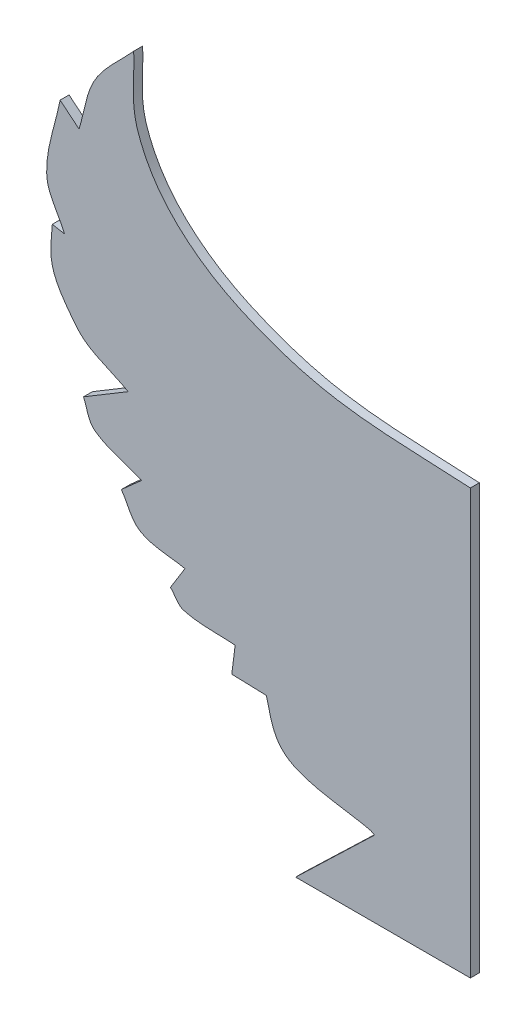
from build123d import *

# Parameters (mm, degrees)
BOSS_EXTRUDE1_DEPTH   = 6.35
BOSS_EXTRUDE1_2_DEPTH = 6.35
SPLIT1_DEPTH          = 6.35


with BuildPart() as part:
    # Sketch3 → Boss-Extrude1 (new body)
    with BuildSketch(Plane.XY):
        with BuildLine():
            Line((-137.255, 0), (-13.43, 0))
            Line((-13.43, 0), (-13.43, 300.741120307))
            add(Edge.make_bspline(
                [(-252.01, 449.51), (-251.22, 434.236666667), (-254.156340493, 418.301689829), (-249.64, 403.69), (-244.9322272, 388.458970352), (-236.172283534, 374.127667064), (-225.15, 362.61), (-212.218015533, 349.096802748), (-196.219330524, 338.256991767), (-179.33, 330.22), (-157.597830165, 319.878484699), (-134.316102268, 312.196417664), (-110.6, 308.1), (-78.590398962, 302.571068912), (-45.873162078, 302.764202533), (-13.43, 300.741120307)],
                knots=[0, 0, 0, 0, 1, 1, 1, 2, 2, 2, 3, 3, 3, 4, 4, 4, 4.924873679, 4.924873679, 4.924873679, 4.924873679], degree=3))
            add(Edge.make_bspline(
                [(-290.72, 382.36), (-287.033333333, 394.21), (-285.858024194, 407.158325377), (-279.66, 417.91), (-272.669822336, 430.035818396), (-261.226666667, 438.976666667), (-252.01, 449.51)],
                knots=[0, 0, 0, 0, 1, 1, 1, 2, 2, 2, 2], degree=3))
            Line((-290.72, 382.36), (-304.15, 393.42))
            add(Edge.make_bspline(
                [(-300.99, 312.84), (-305.203333333, 322.846666667), (-313.20454226, 332.010827623), (-313.63, 342.86), (-314.301915867, 359.993854602), (-307.31, 376.566666667), (-304.15, 393.42)],
                knots=[0, 0, 0, 0, 1, 1, 1, 2, 2, 2, 2], degree=3))
            Line((-300.99, 312.84), (-309.68, 314.42))
            add(Edge.make_bspline(
                [(-255.96, 238.58), (-268.073333333, 245.69), (-283.384566912, 249.056429284), (-292.3, 259.91), (-313.503064948, 285.722426894), (-311.452418298, 293.15098042), (-309.68, 314.42)],
                knots=[0, 0, 0, 0, 1, 1, 1, 2, 2, 2, 2], degree=3))
            Line((-255.96, 238.58), (-287.56, 219.62))
            add(Edge.make_bspline(
                [(-246.48, 188.81), (-257.54, 193.55), (-270.033662794, 195.810247096), (-279.66, 203.03), (-284.559981678, 206.704986258), (-284.926666667, 214.09), (-287.56, 219.62)],
                knots=[0, 0, 0, 0, 1, 1, 1, 2, 2, 2, 2], degree=3))
            Line((-246.48, 188.81), (-260.7, 176.17))
            add(Edge.make_bspline(
                [(-215.67, 150.1), (-226.203333333, 152.47), (-237.926280871, 151.800478399), (-247.27, 157.21), (-253.972610339, 161.090458618), (-256.223333333, 169.85), (-260.7, 176.17)],
                knots=[0, 0, 0, 0, 1, 1, 1, 2, 2, 2, 2], degree=3))
            Line((-215.67, 150.1), (-225.94, 133.51))
            add(Edge.make_bspline(
                [(-180.12, 120.87), (-192.233333333, 121.923333333), (-204.738771159, 120.796557561), (-216.46, 124.03), (-220.768000934, 125.218414051), (-222.78, 130.35), (-225.94, 133.51)],
                knots=[0, 0, 0, 0, 1, 1, 1, 2, 2, 2, 2], degree=3))
            Line((-180.12, 120.87), (-182.49, 101.91))
            Line((-182.49, 101.91), (-158, 101.12))
            add(Edge.make_bspline(
                [(-81.37, 53.72), (-82.423333333, 54.246666667), (-83.38470971, 55.025775564), (-84.53, 55.3), (-102.113096915, 59.51003729), (-120.930466919, 59.824411475), (-137.46, 67.15), (-153.288857754, 74.165061959), (-154.480631293, 87.746398914), (-158, 101.12)],
                knots=[0, 0, 0, 0, 1, 1, 1, 2, 2, 2, 3, 3, 3, 3], degree=3))
            Line((-81.37, 53.72), (-137.255, 0))
        make_face()
    extrude(amount=BOSS_EXTRUDE1_DEPTH)


with BuildPart() as body_2:
    # Sketch3 → Boss-Extrude1 2 (new body)
    with BuildSketch(Plane.XY):
        with BuildLine():
            Line((124.82, 56.09), (115.34, 45.82))
            Line((115.34, 45.82), (137.255, 0))
            Line((137.255, 0), (13.43, 0))
            Line((13.43, 0), (13.43, 303.36))
            add(Edge.make_bspline(
                [(13.43, 303.36), (48.200662718, 304.989874815), (84.838146158, 297.440253156), (117.71, 308.89), (140.125691639, 316.697712818), (163.780989935, 321.676753654), (184.86, 332.59), (201.370913711, 341.138203553), (216.856735382, 352.567697579), (229.1, 366.56), (239.49425252, 378.439145737), (247.126539585, 393.185388797), (251.22, 408.43), (254.976612924, 422.420144682), (251.746666667, 437.396666667), (252.01, 451.88)],
                knots=[0, 0, 0, 0, 1, 1, 1, 2, 2, 2, 3, 3, 3, 4, 4, 4, 5, 5, 5, 5], degree=3))
            add(Edge.make_bspline(
                [(252.01, 451.88), (262.806666667, 437.66), (275.467888324, 424.679424055), (284.4, 409.22), (289.359088029, 400.636963026), (290.193333333, 390.26), (293.09, 380.78)],
                knots=[0, 0, 0, 0, 1, 1, 1, 2, 2, 2, 2], degree=3))
            Line((293.09, 380.78), (306.52, 391.84))
            add(Edge.make_bspline(
                [(306.52, 391.84), (308.89, 373.67), (314.706017241, 355.622293101), (313.63, 337.33), (313.069462696, 327.800865835), (305.73, 319.95), (301.78, 311.26)],
                knots=[0, 0, 0, 0, 1, 1, 1, 2, 2, 2, 2], degree=3))
            Line((301.78, 311.26), (312.84, 312.84))
            add(Edge.make_bspline(
                [(312.84, 312.84), (307.046666667, 296.513333333), (305.032182187, 278.299393468), (295.46, 263.86), (286.698444229, 250.643415871), (269.943782335, 245.00585489), (256.75, 236.21)],
                knots=[0, 0, 0, 0, 1, 1, 1, 2, 2, 2, 2], degree=3))
            Line((256.75, 236.21), (289.14, 215.67))
            add(Edge.make_bspline(
                [(289.14, 215.67), (282.293333333, 209.086666667), (276.435429936, 201.288720512), (268.6, 195.92), (261.982435677, 191.385742964), (253.853333333, 189.6), (246.48, 186.44)],
                knots=[0, 0, 0, 0, 1, 1, 1, 2, 2, 2, 2], degree=3))
            Line((246.48, 186.44), (260.7, 172.22))
            add(Edge.make_bspline(
                [(260.7, 172.22), (253.59, 165.9), (247.726894127, 157.804977508), (239.37, 153.26), (232.243558071, 149.384215793), (223.57, 149.573333333), (215.67, 147.73)],
                knots=[0, 0, 0, 0, 1, 1, 1, 2, 2, 2, 2], degree=3))
            Line((215.67, 147.73), (225.94, 129.56))
            add(Edge.make_bspline(
                [(225.94, 129.56), (215.67, 126.4), (205.631495175, 122.355323954), (195.13, 120.08), (189.719278844, 118.907677083), (184.07, 119.553333333), (178.54, 119.29)],
                knots=[0, 0, 0, 0, 1, 1, 1, 2, 2, 2, 2], degree=3))
            Line((178.54, 119.29), (180.91, 99.54))
            Line((180.91, 99.54), (138.25, 103.49))
            add(Edge.make_bspline(
                [(138.25, 103.49), (136.143333333, 94.536666667), (135.467629965, 85.120311917), (131.93, 76.63), (130.062451251, 72.147883002), (125.61, 69.256666667), (122.45, 65.57)],
                knots=[0, 0, 0, 0, 1, 1, 1, 2, 2, 2, 2], degree=3))
            Line((122.45, 65.57), (124.82, 56.09))
        make_face()
    extrude(amount=BOSS_EXTRUDE1_2_DEPTH)

    # Split1: read off the stored shape, not the designer's step
    # Split1 outline → Split1 (cut)
    with BuildSketch(Plane.XY):
        with BuildLine():
            Line((124.82, 56.09), (122.45, 65.57))
            add(Edge.make_bspline(
                [(122.45, 65.57), (125.61, 69.256666667), (130.062451251, 72.147883002), (131.93, 76.63), (135.467629965, 85.120311917), (136.143333333, 94.536666667), (138.25, 103.49)],
                knots=[0, 0, 0, 0, 1, 1, 1, 2, 2, 2, 2], degree=3))
            Line((138.25, 103.49), (180.91, 99.54))
            Line((180.91, 99.54), (178.54, 119.29))
            add(Edge.make_bspline(
                [(178.54, 119.29), (184.07, 119.553333333), (189.719278844, 118.907677083), (195.13, 120.08), (205.631495175, 122.355323954), (215.67, 126.4), (225.94, 129.56)],
                knots=[0, 0, 0, 0, 1, 1, 1, 2, 2, 2, 2], degree=3))
            Line((225.94, 129.56), (215.67, 147.73))
            add(Edge.make_bspline(
                [(215.67, 147.73), (223.57, 149.573333333), (232.243558071, 149.384215793), (239.37, 153.26), (247.726894127, 157.804977508), (253.59, 165.9), (260.7, 172.22)],
                knots=[0, 0, 0, 0, 1, 1, 1, 2, 2, 2, 2], degree=3))
            Line((260.7, 172.22), (246.48, 186.44))
            add(Edge.make_bspline(
                [(246.48, 186.44), (253.853333333, 189.6), (261.982435677, 191.385742964), (268.6, 195.92), (276.435429936, 201.288720512), (282.293333333, 209.086666667), (289.14, 215.67)],
                knots=[0, 0, 0, 0, 1, 1, 1, 2, 2, 2, 2], degree=3))
            Line((289.14, 215.67), (256.75, 236.21))
            add(Edge.make_bspline(
                [(256.75, 236.21), (269.943782335, 245.00585489), (286.698444229, 250.643415871), (295.46, 263.86), (305.032182187, 278.299393468), (307.046666667, 296.513333333), (312.84, 312.84)],
                knots=[0, 0, 0, 0, 1, 1, 1, 2, 2, 2, 2], degree=3))
            Line((312.84, 312.84), (301.78, 311.26))
            add(Edge.make_bspline(
                [(301.78, 311.26), (305.73, 319.95), (313.069462696, 327.800865835), (313.63, 337.33), (314.706017241, 355.622293101), (308.89, 373.67), (306.52, 391.84)],
                knots=[0, 0, 0, 0, 1, 1, 1, 2, 2, 2, 2], degree=3))
            Line((306.52, 391.84), (293.09, 380.78))
            add(Edge.make_bspline(
                [(293.09, 380.78), (290.193333333, 390.26), (289.359088029, 400.636963026), (284.4, 409.22), (275.467888324, 424.679424055), (262.806666667, 437.66), (252.01, 451.88)],
                knots=[0, 0, 0, 0, 1, 1, 1, 2, 2, 2, 2], degree=3))
            add(Edge.make_bspline(
                [(252.01, 451.88), (251.746666667, 437.396666667), (254.976612924, 422.420144682), (251.22, 408.43), (247.126539585, 393.185388797), (239.49425252, 378.439145737), (229.1, 366.56), (216.856735382, 352.567697579), (201.370913711, 341.138203553), (184.86, 332.59), (163.780989935, 321.676753654), (140.125691639, 316.697712818), (117.71, 308.89), (84.838146158, 297.440253156), (48.200662718, 304.989874815), (13.43, 303.36)],
                knots=[0, 0, 0, 0, 1, 1, 1, 2, 2, 2, 3, 3, 3, 4, 4, 4, 5, 5, 5, 5], degree=3))
            Line((13.43, 303.36), (13.43, 0))
            Line((13.43, 0), (137.255, 0))
            Line((137.255, 0), (115.34, 45.82))
            Line((115.34, 45.82), (124.82, 56.09))
        make_face()
    extrude(amount=SPLIT1_DEPTH, mode=Mode.SUBTRACT)


solid = part.part
